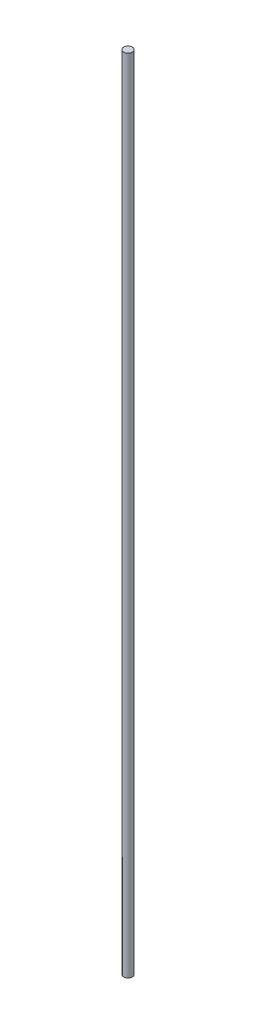
from build123d import *

# Parameters (mm, degrees)
SKETCH1_R           = 3
BOSS_EXTRUDE1_DEPTH = 550


with BuildPart() as part:
    # Sketch1 → Boss-Extrude1 (new body)
    with BuildSketch(Plane(origin=(0, 0, 0), x_dir=(1, 0, 0), z_dir=(0, 1, 0))):
        Circle(SKETCH1_R)
    extrude(amount=BOSS_EXTRUDE1_DEPTH)


solid = part.part
